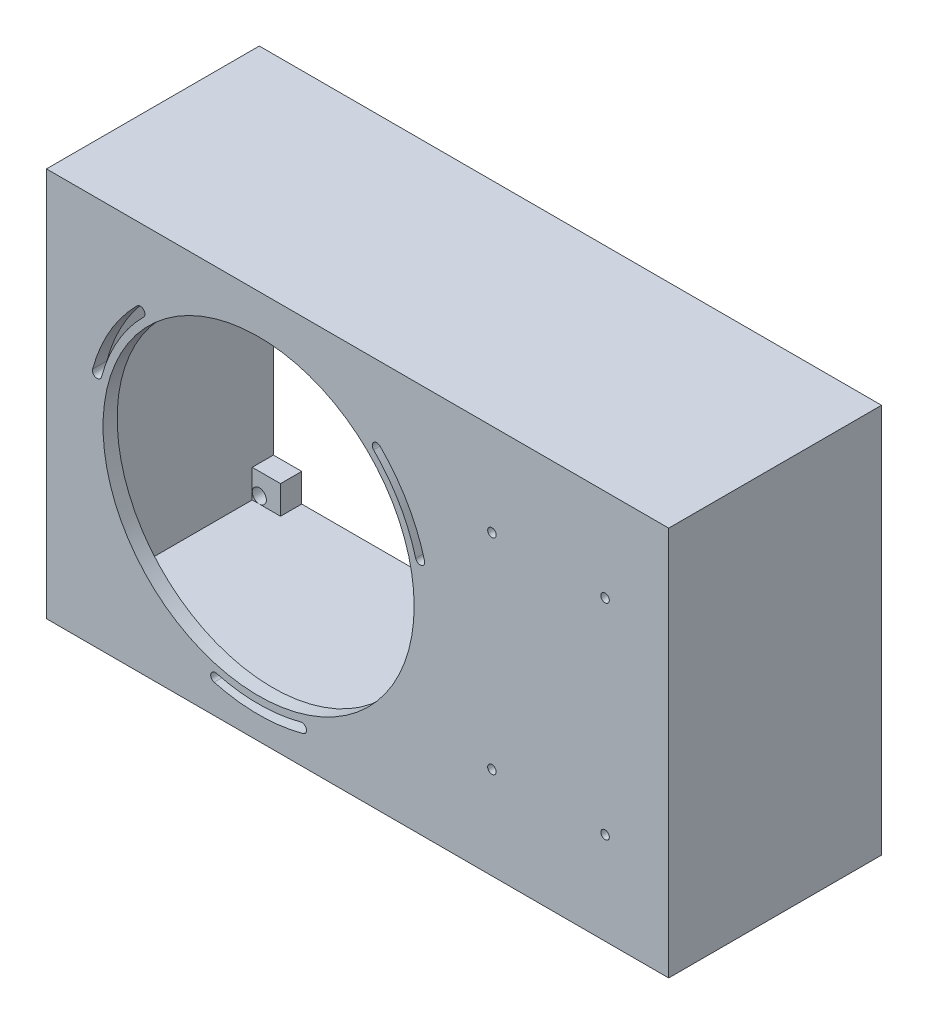
from build123d import *

# Parameters (mm, degrees)
SKETCH_1_W          = 88
SKETCH_1_H          = 55.1
SKETCH_1_W_2        = 84
SKETCH_1_H_2        = 51.1
EXTRUDE_1_DEPTH     = 30.1
SKETCH_2_R          = 22
EXTRUDE_2_DEPTH     = 2
CUT_EXTRUDE_1_DEPTH = 61.008436907
SKETCH_3_W          = 6
SKETCH_3_H          = 6
EXTRUDE_3_DEPTH     = 3
SKETCH_3_3_R        = 1
CUT_EXTRUDE_2_DEPTH = 3
SKETCH_4_R          = 0.6
CUT_EXTRUDE_3_DEPTH = 61.008436907


with BuildPart() as part:
    # 草图1 → 凸台-拉伸1 (new body)
    with BuildSketch(Plane.XY):
        Rectangle(SKETCH_1_W, SKETCH_1_H)
        Rectangle(SKETCH_1_W_2, SKETCH_1_H_2, mode=Mode.SUBTRACT)
    extrude(amount=EXTRUDE_1_DEPTH)

    # 草图2 → 凸台-拉伸2 (add)
    with BuildSketch(Plane.XY.offset(30.1)):
        Polygon((16, 27.55), (-44, 27.55), (-44, -27.55), (16, -27.55), (16, -25.55), (42, -25.55), (42, 25.55), (16, 25.55), align=None)
        with Locations((-14, 0)):
            Circle(SKETCH_2_R, mode=Mode.SUBTRACT)
    extrude(amount=-EXTRUDE_2_DEPTH)

    # 草图2<4> → 切除-拉伸1 (cut, through all)
    with BuildSketch(Plane.XY.offset(30.1)):
        with BuildLine():
            ThreePointArc((9.471997601, 6.289302713), (7.044417333, 12.149999963), (3.182694782, 17.182694784))
            ThreePointArc((3.182694782, 17.182694784), (2.263455968, 17.182694784), (2.263455964, 16.26345597))
            ThreePointArc((2.263455964, 16.26345597), (5.918584278, 11.500000015), (8.216293997, 5.952838067))
            ThreePointArc((8.216293997, 5.952838067), (9.012378115, 5.493218615), (9.471997601, 6.289302713))
        make_face()
        with BuildLine():
            ThreePointArc((-20.289302901, -23.471997551), (-14, -24.3), (-7.710697099, -23.471997551))
            ThreePointArc((-7.710697099, -23.471997551), (-7.251077815, -22.675913342), (-8.047161998, -22.216294014))
            ThreePointArc((-8.047161998, -22.216294014), (-13.999999945, -23), (-19.952837896, -22.216294042))
            ThreePointArc((-19.952837896, -22.216294042), (-20.748922171, -22.675913289), (-20.289302901, -23.471997551))
        make_face()
        with BuildLine():
            ThreePointArc((-31.182694776, 17.18269479), (-35.04441731, 12.150000003), (-37.47199758, 6.289302792))
            ThreePointArc((-37.47199758, 6.289302792), (-37.012378201, 5.493218638), (-36.216294021, 5.952837975))
            ThreePointArc((-36.216294021, 5.952837975), (-33.918584308, 11.499999964), (-30.263455981, 16.263455954))
            ThreePointArc((-30.263455981, 16.263455954), (-30.263455957, 17.182694773), (-31.182694776, 17.18269479))
        make_face()
    extrude(amount=-CUT_EXTRUDE_1_DEPTH, mode=Mode.SUBTRACT)

    # 草图3 → 凸台-拉伸3 (add)
    with BuildSketch(Plane(origin=(0, 0, 0), x_dir=(-1, 0, 0), z_dir=(0, 0, -1))):
        with Locations((-41, 24.55)):
            Rectangle(SKETCH_3_W, SKETCH_3_H)
        with Locations((41, 24.55)):
            Rectangle(SKETCH_3_W, SKETCH_3_H)
        with Locations((-41, -24.55)):
            Rectangle(SKETCH_3_W, SKETCH_3_H)
        with Locations((41, -24.55)):
            Rectangle(SKETCH_3_W, SKETCH_3_H)
    extrude(amount=-EXTRUDE_3_DEPTH)

    # 草图3<3> → 切除-拉伸2 (cut)
    with BuildSketch(Plane(origin=(0, 0, 0), x_dir=(-1, 0, 0), z_dir=(0, 0, -1))):
        with Locations((-41, 24.55)):
            Circle(SKETCH_3_3_R)
        with Locations((-41, -24.55)):
            Circle(SKETCH_3_3_R)
        with Locations((41, -24.55)):
            Circle(SKETCH_3_3_R)
        with Locations((41, 24.55)):
            Circle(SKETCH_3_3_R)
    extrude(amount=-CUT_EXTRUDE_2_DEPTH, mode=Mode.SUBTRACT)

    # 草图4 → 切除-拉伸3 (cut, through all)
    with BuildSketch(Plane.XY.offset(30.1)):
        with Locations((19, 14.5)):
            Circle(SKETCH_4_R)
        with Locations((35, 14.5)):
            Circle(SKETCH_4_R)
        with Locations((19, -14.5)):
            Circle(SKETCH_4_R)
        with Locations((35, -14.5)):
            Circle(SKETCH_4_R)
    extrude(amount=-CUT_EXTRUDE_3_DEPTH, mode=Mode.SUBTRACT)


solid = part.part
